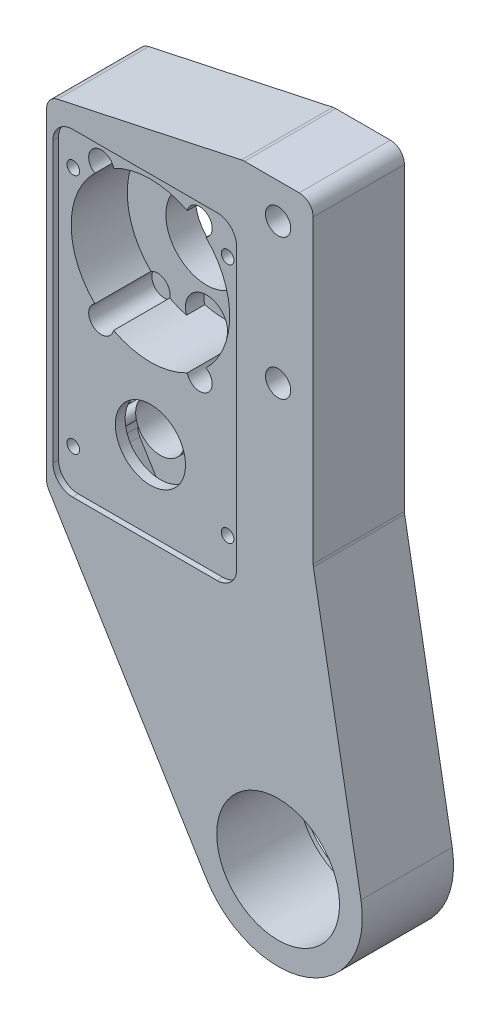
from build123d import *

# Parameters (mm, degrees)
SKETCH1_R             = 2.286
SKETCH1_R_2           = 11.1125
SKETCH1_R_3           = 7.366
BOSS_EXTRUDE1_DEPTH   = 16.51
SKETCH2_R             = 12.7
CUT_EXTRUDE1_DEPTH    = 1.778
CAVITY1_START         = 5.334
CAVITY1_OUTLINE_R     = 1.143
CAVITY1_OUTLINE_R_2   = 7.366
CAVITY1_OUTLINE_R_3   = 4.445
CAVITY1_DEPTH         = 11.176
CAVITY1_START_2       = 15.494
CAVITY1_2_OUTLINE_R   = 1.143
CAVITY1_2_OUTLINE_R_2 = 4.445
CAVITY1_2_DEPTH       = 1.016
CAVITY1_START_3       = 2.286
CAVITY1_3_OUTLINE_R   = 1.143
CAVITY1_3_OUTLINE_R_2 = 4.445
CAVITY1_3_DEPTH       = 3.048
CAVITY1_4_OUTLINE_R   = 1.905
CAVITY1_4_DEPTH       = 3.302
CAVITY1_START_4       = 13.716
CAVITY1_5_DEPTH       = 1.778
CAVITY1_START_5       = 4.064
CAVITY1_6_OUTLINE_R   = 2.286
CAVITY1_6_DEPTH       = 1.27
CAVITY1_START_6       = 2.032
CAVITY1_7_DEPTH       = 0.254
FILLET1_R             = 2.54


# Read off the part's stored shape, not the designer's step: Cavity1
with BuildPart() as part:
    # Sketch1 → Boss-Extrude1 (new body)
    with BuildSketch(Plane.XY):
        with BuildLine():
            Line((-6.35, 19.05), (6.35, 19.05))
            Line((6.35, 19.05), (6.35, -38.1))
            Line((6.35, -38.1), (14.999447267, -86.202930908))
            ThreePointArc((14.999447267, -86.202930908), (5.413612396, -103.146066153), (-13.00522541, -96.844917372))
            Line((-13.00522541, -96.844917372), (-41.91, -49.53))
            Line((-41.91, -49.53), (-41.91, 11.43))
            Line((-41.91, 11.43), (-6.35, 19.05))
        make_face()
        with Locations((0, 12.7)):
            Circle(SKETCH1_R, mode=Mode.SUBTRACT)
        with Locations(Location((0, -12.7, 0), (0, 0, 180))):
            Circle(SKETCH1_R, mode=Mode.SUBTRACT)
        with Locations((0, -88.9)):
            Circle(SKETCH1_R_2, mode=Mode.SUBTRACT)
        with Locations((-24.13, -7.62)):
            Circle(SKETCH1_R_3, mode=Mode.SUBTRACT)
    extrude(amount=BOSS_EXTRUDE1_DEPTH)

    # Sketch2 → Cut-Extrude1 (cut)
    with BuildSketch(Plane(origin=(0, 0, 0), x_dir=(-1, 0, 0), z_dir=(0, 0, -1))):
        with Locations((0, -88.9)):
            Circle(SKETCH2_R)
    extrude(amount=-CUT_EXTRUDE1_DEPTH, mode=Mode.SUBTRACT)

    # Cavity1 outline → Cavity1 (cut)
    # profile 1 of 6: a face of its own
    with BuildSketch(Plane.XY.offset(CAVITY1_START)):
        with Locations((-38.1, 1.524)):
            Circle(CAVITY1_OUTLINE_R)
    # profile 2 of 6: a face of its own
    with BuildSketch(Plane.XY.offset(CAVITY1_START)):
        with BuildLine():
            ThreePointArc((-34.194128852, 2.610567504), (-38.481, -7.62), (-34.194128852, -17.850567504))
            ThreePointArc((-34.194128852, -17.850567504), (-34.366847552, -21.659105214), (-30.793505747, -20.330188518))
            ThreePointArc((-30.793505747, -20.330188518), (-24.13, -21.971), (-17.466494253, -20.330188518))
            ThreePointArc((-17.466494253, -20.330188518), (-13.893152448, -21.659105214), (-14.065871148, -17.850567504))
            ThreePointArc((-14.065871148, -17.850567504), (-9.779, -7.62), (-14.065871148, 2.610567504))
            ThreePointArc((-14.065871148, 2.610567504), (-13.893152448, 6.419105214), (-17.466494253, 5.090188518))
            ThreePointArc((-17.466494253, 5.090188518), (-24.13, 6.731), (-30.793505747, 5.090188518))
            ThreePointArc((-30.793505747, 5.090188518), (-34.366847552, 6.419105214), (-34.194128852, 2.610567504))
        make_face()
        with Locations((-24.13, -7.62)):
            Circle(CAVITY1_OUTLINE_R_2, mode=Mode.SUBTRACT)
    # profile 3 of 6: a face of its own
    with BuildSketch(Plane.XY.offset(CAVITY1_START)):
        with Locations((-38.1, -42.164)):
            Circle(CAVITY1_OUTLINE_R)
    # profile 4 of 6: a face of its own
    with BuildSketch(Plane.XY.offset(CAVITY1_START)):
        with Locations((-24.13, -33.02)):
            Circle(CAVITY1_OUTLINE_R_3)
    # profile 5 of 6: a face of its own
    with BuildSketch(Plane.XY.offset(CAVITY1_START)):
        with Locations((-10.16, 1.524)):
            Circle(CAVITY1_OUTLINE_R)
    # profile 6 of 6: a face of its own
    with BuildSketch(Plane.XY.offset(CAVITY1_START)):
        with Locations((-10.16, -42.164)):
            Circle(CAVITY1_OUTLINE_R)
    extrude(amount=CAVITY1_DEPTH, mode=Mode.SUBTRACT)

    # Cavity1 2 outline → Cavity1 2 (cut)
    with BuildSketch(Plane.XY.offset(CAVITY1_START_2)):
        with BuildLine():
            ThreePointArc((-40.767, -45.593), (-39.725471714, -48.107471714), (-37.211, -49.149))
            Line((-37.211, -49.149), (-11.049, -49.149))
            ThreePointArc((-11.049, -49.149), (-8.534528286, -48.107471714), (-7.493, -45.593))
            Line((-7.493, -45.593), (-7.493, 4.953))
            ThreePointArc((-7.493, 4.953), (-8.534528286, 7.467471714), (-11.049, 8.509))
            Line((-11.049, 8.509), (-37.211, 8.509))
            ThreePointArc((-37.211, 8.509), (-39.725471714, 7.467471714), (-40.767, 4.953))
            Line((-40.767, 4.953), (-40.767, -45.593))
        make_face()
        with Locations((-38.1, 1.524)):
            Circle(CAVITY1_2_OUTLINE_R, mode=Mode.SUBTRACT)
        with BuildLine():
            ThreePointArc((-34.194128852, 2.610567504), (-34.366847552, 6.419105214), (-30.793505747, 5.090188518))
            ThreePointArc((-30.793505747, 5.090188518), (-24.13, 6.731), (-17.466494253, 5.090188518))
            ThreePointArc((-17.466494253, 5.090188518), (-13.893152448, 6.419105214), (-14.065871148, 2.610567504))
            ThreePointArc((-14.065871148, 2.610567504), (-9.779, -7.62), (-14.065871148, -17.850567504))
            ThreePointArc((-14.065871148, -17.850567504), (-13.893152448, -21.659105214), (-17.466494253, -20.330188518))
            ThreePointArc((-17.466494253, -20.330188518), (-24.13, -21.971), (-30.793505747, -20.330188518))
            ThreePointArc((-30.793505747, -20.330188518), (-34.366847552, -21.659105214), (-34.194128852, -17.850567504))
            ThreePointArc((-34.194128852, -17.850567504), (-38.481, -7.62), (-34.194128852, 2.610567504))
        make_face(mode=Mode.SUBTRACT)
        with Locations((-24.13, -33.02)):
            Circle(CAVITY1_2_OUTLINE_R_2, mode=Mode.SUBTRACT)
        with Locations((-38.1, -42.164)):
            Circle(CAVITY1_2_OUTLINE_R, mode=Mode.SUBTRACT)
        with Locations((-10.16, 1.524)):
            Circle(CAVITY1_2_OUTLINE_R, mode=Mode.SUBTRACT)
        with Locations((-10.16, -42.164)):
            Circle(CAVITY1_2_OUTLINE_R, mode=Mode.SUBTRACT)
    extrude(amount=CAVITY1_2_DEPTH, mode=Mode.SUBTRACT)

    # Cavity1 3 outline → Cavity1 3 (cut)
    with BuildSketch(Plane.XY.offset(CAVITY1_START_3)):
        with Locations((-38.1, 1.524)):
            Circle(CAVITY1_3_OUTLINE_R)
        with Locations((-38.1, -42.164)):
            Circle(CAVITY1_3_OUTLINE_R)
        with BuildLine():
            ThreePointArc((-20.50956216, -21.506815), (-24.13, -16.51), (-27.75043784, -21.506815))
            ThreePointArc((-27.75043784, -21.506815), (-24.13, -21.971), (-20.50956216, -21.506815))
        make_face()
        with Locations((-24.13, -33.02)):
            Circle(CAVITY1_3_OUTLINE_R_2)
        with Locations((-10.16, 1.524)):
            Circle(CAVITY1_3_OUTLINE_R)
        with Locations((-10.16, -42.164)):
            Circle(CAVITY1_3_OUTLINE_R)
    extrude(amount=CAVITY1_3_DEPTH, mode=Mode.SUBTRACT)

    # Cavity1 4 outline → Cavity1 4 (cut)
    with BuildSketch(Plane.XY):
        with Locations((-38.1, 1.524)):
            Circle(CAVITY1_4_OUTLINE_R)
        with Locations((-38.1, -42.164)):
            Circle(CAVITY1_4_OUTLINE_R)
        with Locations((-10.16, 1.524)):
            Circle(CAVITY1_4_OUTLINE_R)
        with Locations((-10.16, -42.164)):
            Circle(CAVITY1_4_OUTLINE_R)
    extrude(amount=CAVITY1_4_DEPTH, mode=Mode.SUBTRACT)

    # Cavity1 5 outline → Cavity1 5 (cut)
    with BuildSketch(Plane.XY.offset(CAVITY1_START_4)):
        with BuildLine():
            Line((-28.458512749, -32.009058667), (-30.399761763, -33.918725966))
            ThreePointArc((-30.399761763, -33.918725966), (-29.735544051, -37.908349777), (-26.797234263, -40.687669641))
            Line((-26.797234263, -40.687669641), (-25.65265334, -37.196068942))
            ThreePointArc((-25.65265334, -37.196068942), (-28.039642573, -35.1348806), (-28.458512749, -32.009058667))
        make_face()
        with BuildLine():
            ThreePointArc((-25.391900971, -28.701648336), (-28.711043619, -30.52766679), (-30.399761763, -33.918725966))
            Line((-30.399761763, -33.918725966), (-28.458512749, -32.009058667))
            ThreePointArc((-28.458512749, -32.009058667), (-27.357510815, -29.963662495), (-25.375086436, -28.752941907))
            Line((-25.375086436, -28.752941907), (-25.391900971, -28.701648336))
        make_face()
        with BuildLine():
            ThreePointArc((-25.033307826, -28.639577582), (-25.213049158, -28.66804351), (-25.391900971, -28.701648336))
            Line((-25.391900971, -28.701648336), (-25.375086436, -28.752941907))
            ThreePointArc((-25.375086436, -28.752941907), (-25.223135952, -28.711510846), (-25.069813075, -28.675488936))
            Line((-25.069813075, -28.675488936), (-25.033307826, -28.639577582))
        make_face()
        with BuildLine():
            Line((-25.65265334, -37.196068942), (-26.797234263, -40.687669641))
            ThreePointArc((-26.797234263, -40.687669641), (-24.13, -41.275), (-21.462765737, -40.687669641))
            Line((-21.462765737, -40.687669641), (-22.60734666, -37.196068942))
            ThreePointArc((-22.60734666, -37.196068942), (-24.13, -37.465), (-25.65265334, -37.196068942))
        make_face()
        with BuildLine():
            Line((-23.190186925, -28.675488936), (-23.226692174, -28.639577582))
            ThreePointArc((-23.226692174, -28.639577582), (-23.67719342, -28.591164969), (-24.130000054, -28.575))
            ThreePointArc((-24.130000054, -28.575), (-23.657414944, -28.600193628), (-23.190186925, -28.675488936))
        make_face()
        with BuildLine():
            ThreePointArc((-22.868099029, -28.701648336), (-23.046950842, -28.66804351), (-23.226692174, -28.639577582))
            Line((-23.226692174, -28.639577582), (-23.190186925, -28.675488936))
            ThreePointArc((-23.190186925, -28.675488936), (-23.036864049, -28.711510846), (-22.884913564, -28.752941907))
            Line((-22.884913564, -28.752941907), (-22.868099029, -28.701648336))
        make_face()
        with BuildLine():
            ThreePointArc((-24.130000054, -28.575), (-24.582806633, -28.591164973), (-25.033307826, -28.639577582))
            Line((-25.033307826, -28.639577582), (-25.069813075, -28.675488936))
            ThreePointArc((-25.069813075, -28.675488936), (-24.60258511, -28.600193634), (-24.130000054, -28.575))
        make_face()
        with BuildLine():
            Line((-22.60734666, -37.196068942), (-21.462765737, -40.687669641))
            ThreePointArc((-21.462765737, -40.687669641), (-18.77932539, -38.344470897), (-17.78, -34.925))
            ThreePointArc((-17.78, -34.925), (-17.800091344, -34.420266009), (-17.860238237, -33.918725967))
            Line((-17.860238237, -33.918725967), (-19.80148725, -32.009058668))
            ThreePointArc((-19.80148725, -32.009058668), (-19.71421784, -32.511184794), (-19.685, -33.02))
            ThreePointArc((-19.685, -33.02), (-20.488144766, -35.5685124), (-22.60734666, -37.196068942))
        make_face()
        with BuildLine():
            ThreePointArc((-17.860238237, -33.918725967), (-19.548956381, -30.52766679), (-22.868099029, -28.701648336))
            Line((-22.868099029, -28.701648336), (-22.884913564, -28.752941907))
            ThreePointArc((-22.884913564, -28.752941907), (-20.902489185, -29.963662496), (-19.80148725, -32.009058668))
            Line((-19.80148725, -32.009058668), (-17.860238237, -33.918725967))
        make_face()
    extrude(amount=CAVITY1_5_DEPTH, mode=Mode.SUBTRACT)

    # Cavity1 6 outline → Cavity1 6 (cut)
    with BuildSketch(Plane.XY.offset(CAVITY1_START_5)):
        with Locations((-33.02, 4.572)):
            Circle(CAVITY1_6_OUTLINE_R)
        with Locations((-33.02, -19.812)):
            Circle(CAVITY1_6_OUTLINE_R)
        with Locations((-15.24, 4.572)):
            Circle(CAVITY1_6_OUTLINE_R)
        with Locations((-15.24, -19.812)):
            Circle(CAVITY1_6_OUTLINE_R)
    extrude(amount=CAVITY1_6_DEPTH, mode=Mode.SUBTRACT)

    # Cavity1 7 outline → Cavity1 7 (cut)
    with BuildSketch(Plane.XY.offset(CAVITY1_START_6)):
        with BuildLine():
            ThreePointArc((-20.50956216, -21.506815), (-24.13, -16.51), (-27.75043784, -21.506815))
            ThreePointArc((-27.75043784, -21.506815), (-24.13, -21.971), (-20.50956216, -21.506815))
        make_face()
    extrude(amount=CAVITY1_7_DEPTH, mode=Mode.SUBTRACT)

    # Fillet1
    fillet1_edges = [part.edges().sort_by_distance(p)[0] for p in [
        (6.35, -38.1, 8.255),
        (-41.91, -49.53, 8.255),
        (-41.91, 11.43, 8.255),
        (-6.35, 19.05, 8.255),
        (6.35, 19.05, 8.255),
    ]]
    fillet(fillet1_edges, radius=FILLET1_R)


solid = part.part
